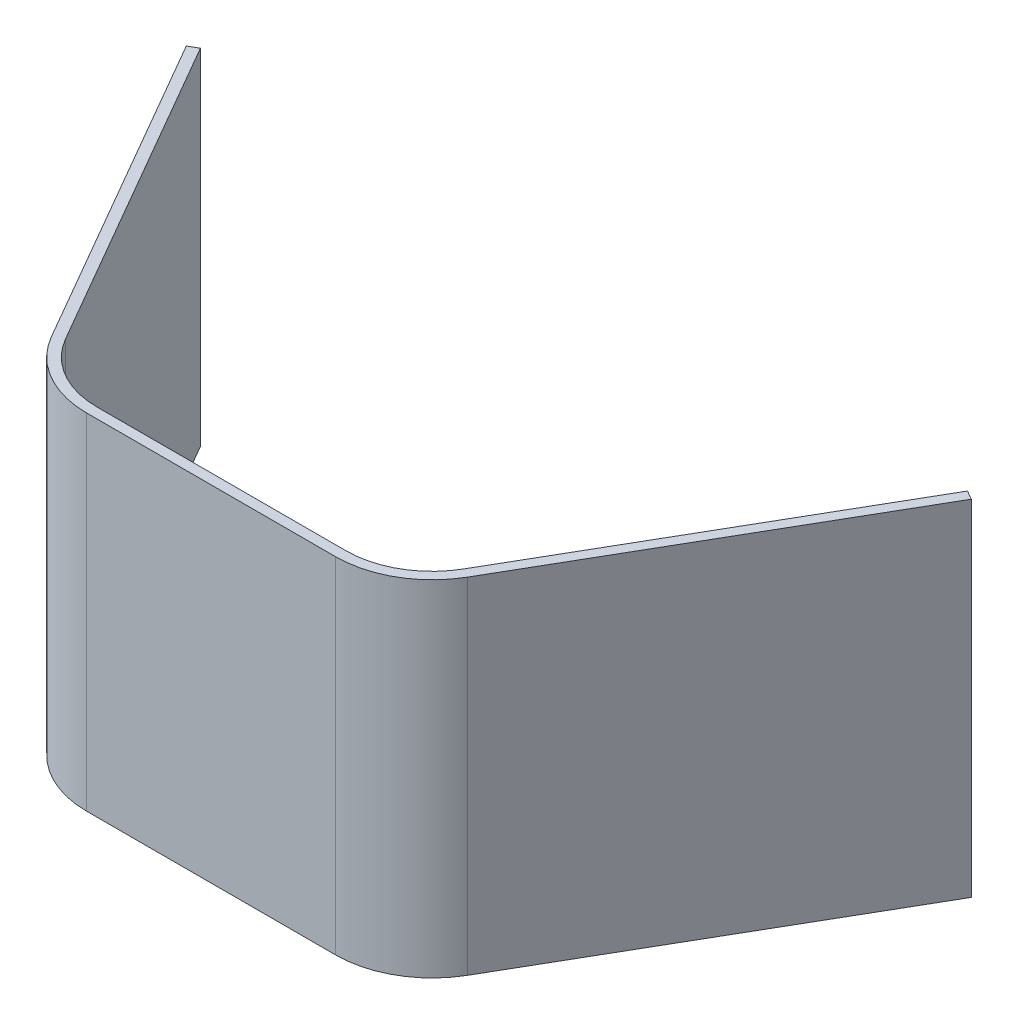
from build123d import *

# Parameters (mm, degrees)
BOSS_EXTRU_1_DEPTH = 40


with BuildPart() as part:
    # Esquisse1 → Boss.-Extru.1 (new body)
    with BuildSketch(Plane(origin=(0, 0, 0), x_dir=(1, 0, 0), z_dir=(0, 1, 0))):
        with BuildLine():
            Line((-45.518615231, 77.640554271), (-24.133241252, 40.6))
            ThreePointArc((-24.133241252, 40.6), (-20.03375673, 36.500515478), (-14.43375673, 35))
            Line((-14.43375673, 35), (14.43375673, 35))
            ThreePointArc((14.43375673, 35), (20.03375673, 36.500515478), (24.133241252, 40.6))
            Line((24.133241252, 40.6), (45.518615231, 77.640554271))
            Line((45.518615231, 77.640554271), (44.479384747, 78.240554271))
            Line((44.479384747, 78.240554271), (23.094010768, 41.2))
            ThreePointArc((23.094010768, 41.2), (19.43375673, 37.539745962), (14.43375673, 36.2))
            Line((14.43375673, 36.2), (-14.43375673, 36.2))
            ThreePointArc((-14.43375673, 36.2), (-19.43375673, 37.539745962), (-23.094010768, 41.2))
            Line((-23.094010768, 41.2), (-44.479384747, 78.240554271))
            Line((-44.479384747, 78.240554271), (-45.518615231, 77.640554271))
        make_face()
    extrude(amount=BOSS_EXTRU_1_DEPTH)


solid = part.part
